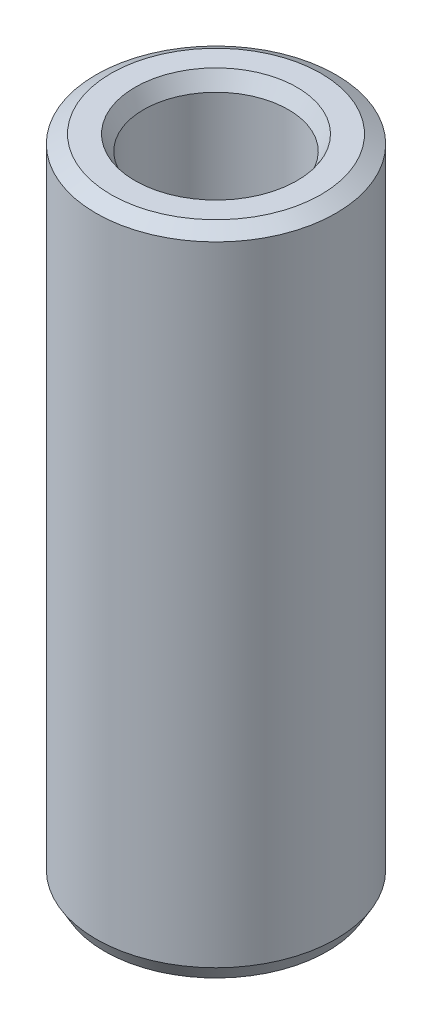
from build123d import *
from OCP.BRepFilletAPI import BRepFilletAPI_MakeChamfer

# Parameters (mm, degrees)
SKETCH1_R           = 20
BOSS_EXTRUDE1_DEPTH = 108.701334121
SKETCH2_R           = 12.054242227
CUT_EXTRUDE1_DEPTH  = 113.320879803
CHAMFER1_SIZE       = 1.442131718
CHAMFER1_SIZE2      = 2.497845408


with BuildPart() as part:
    # Sketch1 → Boss-Extrude1 (new body)
    with BuildSketch(Plane(origin=(0, 0, 0), x_dir=(1, 0, 0), z_dir=(0, 1, 0))):
        Circle(SKETCH1_R)
    extrude(amount=BOSS_EXTRUDE1_DEPTH)

    # Sketch2 → Cut-Extrude1 (cut, through all)
    with BuildSketch(Plane(origin=(0, 0, 0), x_dir=(1, 0, 0), z_dir=(0, 1, 0))):
        Circle(SKETCH2_R)
    extrude(amount=CUT_EXTRUDE1_DEPTH, mode=Mode.SUBTRACT)

    # Chamfer1: one chamfer whose edges measure the first distance from different faces: ONE call of the kernel's chamfer builder (chamfer() names one face for all edges)
    chamfer1_edges_1 = [part.edges().sort_by_distance(p)[0] for p in [
        (-12.054242227, 108.701334121, 0),
    ]]
    chamfer1_side_1 = [part.faces().sort_by_distance(p)[0] for p in [
        (-19.434314575, 108.701334121, 0),
    ]]
    chamfer1_edges_2 = [part.edges().sort_by_distance(p)[0] for p in [
        (-12.054242227, 0, 0),
    ]]
    chamfer1_side_2 = [part.faces().sort_by_distance(p)[0] for p in [
        (-12.054242227, 54.350667061, 0),
    ]]
    chamfer1_edges_3 = [part.edges().sort_by_distance(p)[0] for p in [
        (-20, 0, 0),
    ]]
    chamfer1_side_3 = [part.faces().sort_by_distance(p)[0] for p in [
        (-19.434314575, 0, 0),
    ]]
    chamfer1_edges_4 = [part.edges().sort_by_distance(p)[0] for p in [
        (-20, 108.701334121, 0),
    ]]
    chamfer1_side_4 = [part.faces().sort_by_distance(p)[0] for p in [
        (-20, 54.350667061, 0),
    ]]
    chamfer1 = BRepFilletAPI_MakeChamfer(part.part.solid().wrapped)
    for e in chamfer1_edges_1:
        chamfer1.Add(CHAMFER1_SIZE, CHAMFER1_SIZE2, e.wrapped, chamfer1_side_1[0].wrapped)  # the first distance lies on this face
    for e in chamfer1_edges_2:
        chamfer1.Add(CHAMFER1_SIZE, CHAMFER1_SIZE2, e.wrapped, chamfer1_side_2[0].wrapped)  # the first distance lies on this face
    for e in chamfer1_edges_3:
        chamfer1.Add(CHAMFER1_SIZE, CHAMFER1_SIZE2, e.wrapped, chamfer1_side_3[0].wrapped)  # the first distance lies on this face
    for e in chamfer1_edges_4:
        chamfer1.Add(CHAMFER1_SIZE, CHAMFER1_SIZE2, e.wrapped, chamfer1_side_4[0].wrapped)  # the first distance lies on this face
    add(Compound.cast(chamfer1.Shape()), mode=Mode.REPLACE)


solid = part.part
